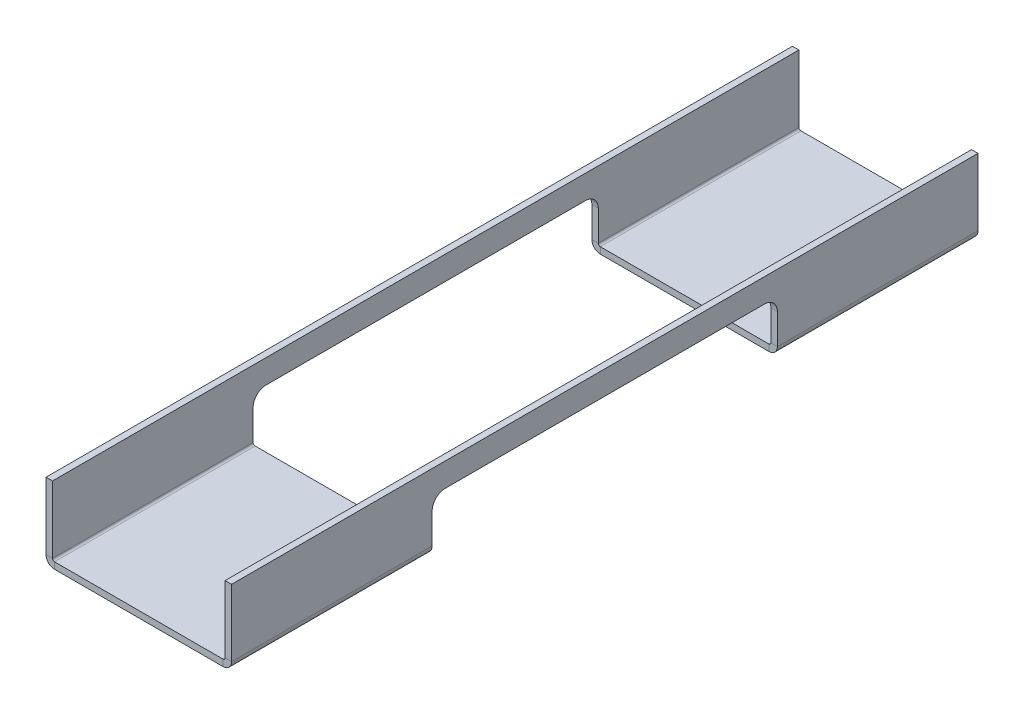
from build123d import *

# Parameters (mm, degrees)
BASE_FLANGE1_DEPTH = 274.6375
SKETCH2_W          = 91.44
SKETCH2_H          = 127
CUT_EXTRUDE1_DEPTH = 19.05
FILLET1_R          = 4.7625


# Sheet-metal steps are written as plain solids
with BuildPart() as part:
    # Sketch1 → Base-Flange1 (new body)
    with BuildSketch(Plane.XY):
        with BuildLine():
            Line((0, 25.4), (0, 0.7366))
            ThreePointArc((0, 0.7366), (0.215745145, 0.215745145), (0.7366, 0))
            Line((0.7366, 0), (62.7634, 0))
            ThreePointArc((62.7634, 0), (63.284254855, 0.215745145), (63.5, 0.7366))
            Line((63.5, 0.7366), (63.5, 25.4))
            Line((63.5, 25.4), (65.88125, 25.4))
            Line((65.88125, 25.4), (65.88125, 0.7366))
            ThreePointArc((65.88125, 0.7366), (64.968052878, -1.468052878), (62.7634, -2.38125))
            Line((62.7634, -2.38125), (0.7366, -2.38125))
            ThreePointArc((0.7366, -2.38125), (-1.468052878, -1.468052878), (-2.38125, 0.7366))
            Line((-2.38125, 0.7366), (-2.38125, 25.4))
            Line((-2.38125, 25.4), (0, 25.4))
        make_face()
    extrude(amount=BASE_FLANGE1_DEPTH)

    # Sketch2 → Cut-Extrude1 (cut)
    with BuildSketch(Plane.XZ.offset(2.38125)):
        with Locations((31.75, 137.31875)):
            Rectangle(SKETCH2_W, SKETCH2_H)
    extrude(amount=-CUT_EXTRUDE1_DEPTH, mode=Mode.SUBTRACT)

    # Fillet1
    fillet1_edges = [part.edges().sort_by_distance(p)[0] for p in [
        (-1.190625, 16.66875, 73.81875),
        (64.690625, 16.66875, 73.81875),
        (64.690625, 16.66875, 200.81875),
        (-1.190625, 16.66875, 200.81875),
    ]]
    fillet(fillet1_edges, radius=FILLET1_R)


solid = part.part
